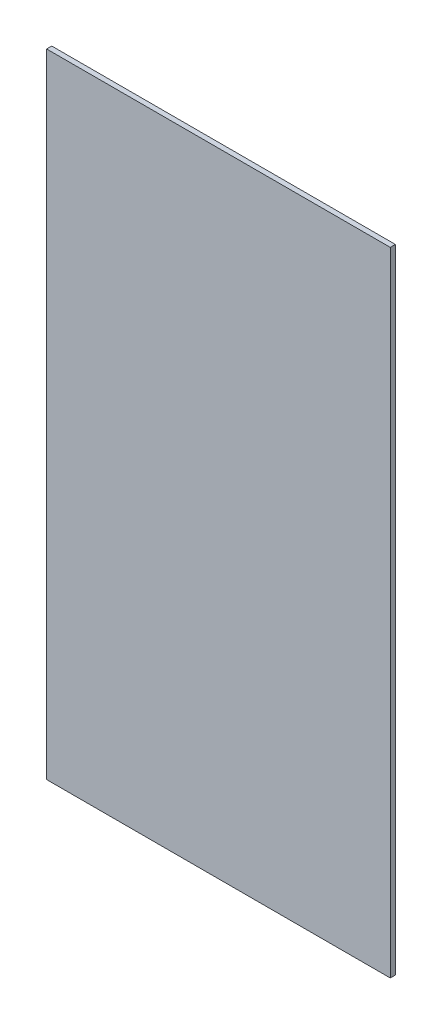
from build123d import *

# Parameters (mm, degrees)
SKETCH1_W           = 155
SKETCH1_H           = 285.39
BOSS_EXTRUDE1_DEPTH = 2.305


with BuildPart() as part:
    # Sketch1 → Boss-Extrude1 (new body)
    with BuildSketch(Plane.XY):
        Rectangle(SKETCH1_W, SKETCH1_H)
    extrude(amount=BOSS_EXTRUDE1_DEPTH)


solid = part.part
